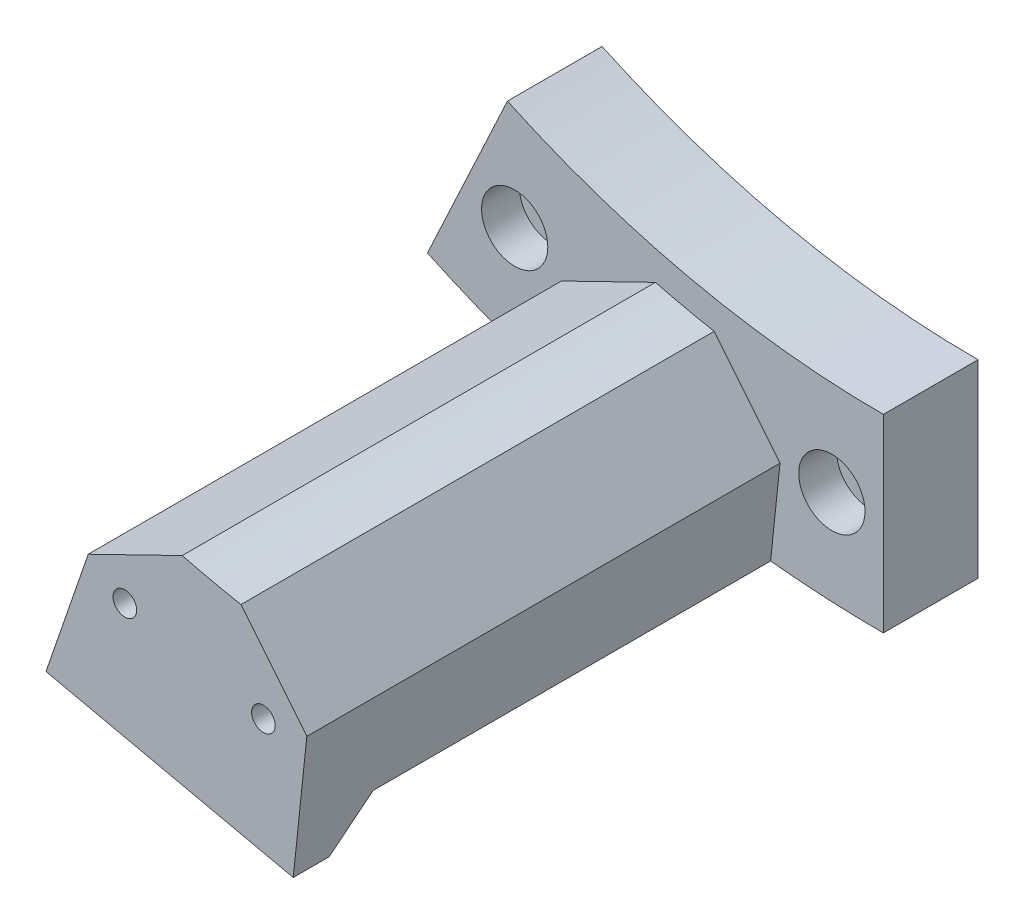
from build123d import *

# Parameters (mm, degrees)
BOSS_EXTRU_1_DEPTH      = 10
BOSS_EXTRU_2_DEPTH      = 48
BOSS_EXTRU_3_DEPTH      = 2
CHANFREIN1_SIZE         = 6
ENL_V_MAT_EXTRU_1_REACH = 138.536
ESQUISSE5_R             = 1.75
ESQUISSE6_R             = 3.5
ENL_V_MAT_EXTRU_2_DEPTH = 4
CHANFREIN2_SIZE         = 7.5
ESQUISSE7_R             = 1.25
ENL_V_MAT_EXTRU_3_DEPTH = 10


with BuildPart() as part:
    # Esquisse1 → Boss.-Extru.1 (new body)
    with BuildSketch(Plane.XY):
        with BuildLine():
            Line((-39.726116604, -85.192931981), (-48.178481838, -103.319087722))
            ThreePointArc((-48.178481838, -103.319087722), (-24.674115989, -111.297744812), (0, -114))
            Line((0, -114), (0, -94))
            ThreePointArc((0, -94), (-20.34532371, -91.771824669), (-39.726116604, -85.192931981))
        make_face()
    extrude(amount=BOSS_EXTRU_1_DEPTH)

    # Esquisse2 → Boss.-Extru.2 (add)
    with BuildSketch(Plane.XY.offset(10)):
        with BuildLine():
            Line((-31.580110982, -91.715301833), (-37.114769608, -107.789117618))
            ThreePointArc((-37.114769608, -107.789117618), (-24.674115989, -111.297744812), (-11.916244813, -113.375496072))
            Line((-11.916244813, -113.375496072), (-10.139260937, -96.468623851))
            ThreePointArc((-10.139260937, -96.468623851), (-20.994642552, -94.700712691), (-31.580110982, -91.715301833))
        make_face()
    extrude(amount=BOSS_EXTRU_2_DEPTH)

    # Esquisse4 → Boss.-Extru.3 (add)
    with BuildSketch(Plane.XY.offset(58)):
        with BuildLine():
            Line((-38.485369249, -111.769628004), (-12.356296065, -117.562304069))
            Line((-12.356296065, -117.562304069), (-10.139260937, -96.468623851))
            ThreePointArc((-10.139260937, -96.468623851), (-20.994642552, -94.700712691), (-31.580110982, -91.715301833))
            Line((-31.580110982, -91.715301833), (-38.485369249, -111.769628004))
        make_face()
    extrude(amount=BOSS_EXTRU_3_DEPTH)

    # Chanfrein1
    # the kernel refuses this chamfer: 6 mm, written as the material it adds along each edge
    with BuildSketch(Plane(origin=(0, 0, 58), x_dir=(-0.3255681544571537, -0.9455185755993178, 0), z_dir=(-0.9455185755993178, 0.3255681544571537, 0))) as chanfrein1_piece_1_section:
        Polygon((114 + CHANFREIN1_SIZE, 0), (114, -CHANFREIN1_SIZE), (114, 0), align=None)
    chanfrein1_piece_1 = revolve(axis=Axis((0, 0, 58), (0, 0, 1)), revolution_arc=13, mode=Mode.PRIVATE)
    chanfrein1_piece_1 = split(chanfrein1_piece_1, bisect_by=Plane(origin=(-25.420832657, -114.665966036, 58), z_dir=(0.21643961393810382, 0.9762960071199333, 0)), keep=Keep.TOP, mode=Mode.PRIVATE)
    add(chanfrein1_piece_1)

    # Esquisse5 → Enlèv. mat.-Extru.1 (cut, up to next)
    with BuildSketch(Plane.XY.offset(10), mode=Mode.PRIVATE) as enl_v_mat_extru_1_sk1:
        with Locations((-5.442939449, -103.857471614)):
            Circle(ESQUISSE5_R)
    enl_v_mat_extru_1_tool1 = extrude(enl_v_mat_extru_1_sk1.sketch, amount=-ENL_V_MAT_EXTRU_1_REACH, mode=Mode.PRIVATE) & part.part
    # Esquisse5 → Enlèv. mat.-Extru.1 (cut, up to next)
    with BuildSketch(Plane.XY.offset(10), mode=Mode.PRIVATE) as enl_v_mat_extru_1_sk2:
        with Locations((-38.959085715, -96.427120875)):
            Circle(ESQUISSE5_R)
    enl_v_mat_extru_1_tool2 = extrude(enl_v_mat_extru_1_sk2.sketch, amount=-ENL_V_MAT_EXTRU_1_REACH, mode=Mode.PRIVATE) & part.part
    add(enl_v_mat_extru_1_tool1.solids().sort_by_distance((-5.442939, -103.857472, 10))[0], mode=Mode.SUBTRACT)
    add(enl_v_mat_extru_1_tool2.solids().sort_by_distance((-38.959086, -96.427121, 10))[0], mode=Mode.SUBTRACT)

    # Esquisse6 → Enlèv. mat.-Extru.2 (cut)
    with BuildSketch(Plane.XY.offset(10)):
        with Locations((-38.959085715, -96.427120875)):
            Circle(ESQUISSE6_R)
        with Locations((-5.442939449, -103.857471614)):
            Circle(ESQUISSE6_R)
    extrude(amount=-ENL_V_MAT_EXTRU_2_DEPTH, mode=Mode.SUBTRACT)

    # Chanfrein2
    # the kernel refuses this chamfer: 7.5 mm, written as the material it takes off along each edge
    with BuildSketch(Plane(origin=(-10.139260937, -96.468623851, 10), x_dir=(-0.10452846326693861, -0.9945218953683486, 0), z_dir=(0, 0, 1)), Plane(origin=(-31.580110982, -91.715301833, 80.112002728), x_dir=(-0.3255681544565627, -0.9455185755995213, 0), z_dir=(0, 0, -1))) as chanfrein2_piece_1:
        with BuildLine():
            Line((CHANFREIN2_SIZE, 0), (-0.315356984, -7.815356984))
            ThreePointArc((-0.315356984, -7.815356984), (-0.083387766, -4.021227803), (0, 0))
            Line((0, 0), (CHANFREIN2_SIZE, 0))
        make_face()
    extrude(amount=70.112002728, mode=Mode.SUBTRACT)

    # Esquisse7 → Enlèv. mat.-Extru.3 (cut)
    with BuildSketch(Plane.XY.offset(60)):
        with Locations((-30.156599324, -101.375931647)):
            Circle(ESQUISSE7_R)
        with Locations((-15.512159217, -104.622525856)):
            Circle(ESQUISSE7_R)
    extrude(amount=-ENL_V_MAT_EXTRU_3_DEPTH, mode=Mode.SUBTRACT)


solid = part.part
